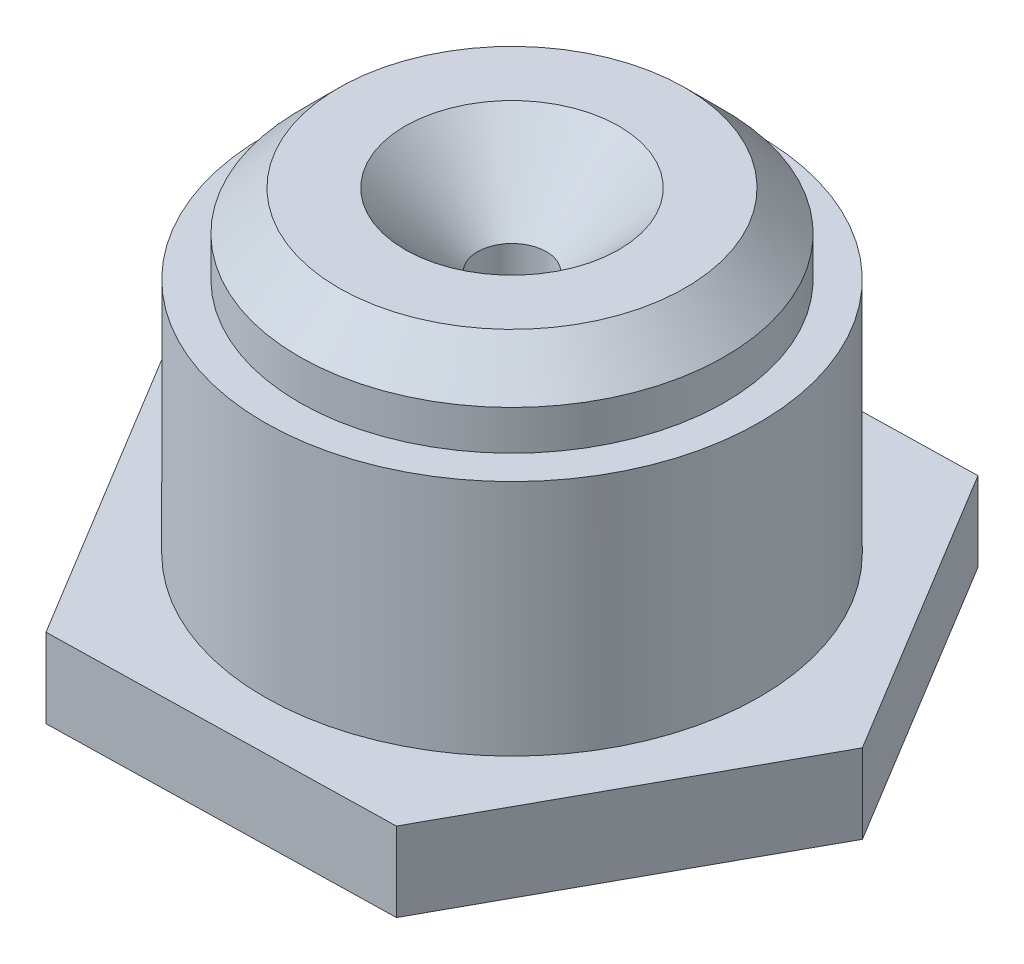
from build123d import *

# Parameters (mm, degrees)
BOSS_EXTRUDE2_DEPTH = 5.08
SKETCH2_R           = 2.2098
CUT_EXTRUDE2_DEPTH  = 36.861213071
CHAMFER2_SIZE       = 2.54


with BuildPart() as part:
    # Sketch1 → Revolve1 (revolve)
    with BuildSketch(Plane.XY):
        Polygon((-15.875, 15.24), (-13.64869, 15.24), (-13.64869, 20.32), (-6.858, 20.32), (-2.2098, 15.6718), (0, 15.6718), (0, 0), (-15.875, 0), align=None)
    revolve(axis=Axis((0, 110.151211274, 0), (0, -1, 0)))

    # Sketch12 → Boss-Extrude2 (add)
    with BuildSketch(Plane.XZ):
        Polygon((-21.992027441, 0.469818106), (-11.402888135, -18.810745391), (10.589139305, -19.280563497), (21.992027441, -0.469818106), (11.402888135, 18.810745391), (-10.589139305, 19.280563497), align=None)
    extrude(amount=BOSS_EXTRUDE2_DEPTH)

    # Sketch2 → Cut-Extrude2 (cut, through all)
    with BuildSketch(Plane(origin=(0, 15.6718, 0), x_dir=(1, 0, 0), z_dir=(0, 1, 0))):
        Circle(SKETCH2_R)
    extrude(amount=-CUT_EXTRUDE2_DEPTH, mode=Mode.SUBTRACT)

    # Chamfer2
    chamfer2_edges = [part.edges().sort_by_distance(p)[0] for p in [
        (13.64869, 20.32, 0),
    ]]
    chamfer(chamfer2_edges, length=CHAMFER2_SIZE)


solid = part.part
